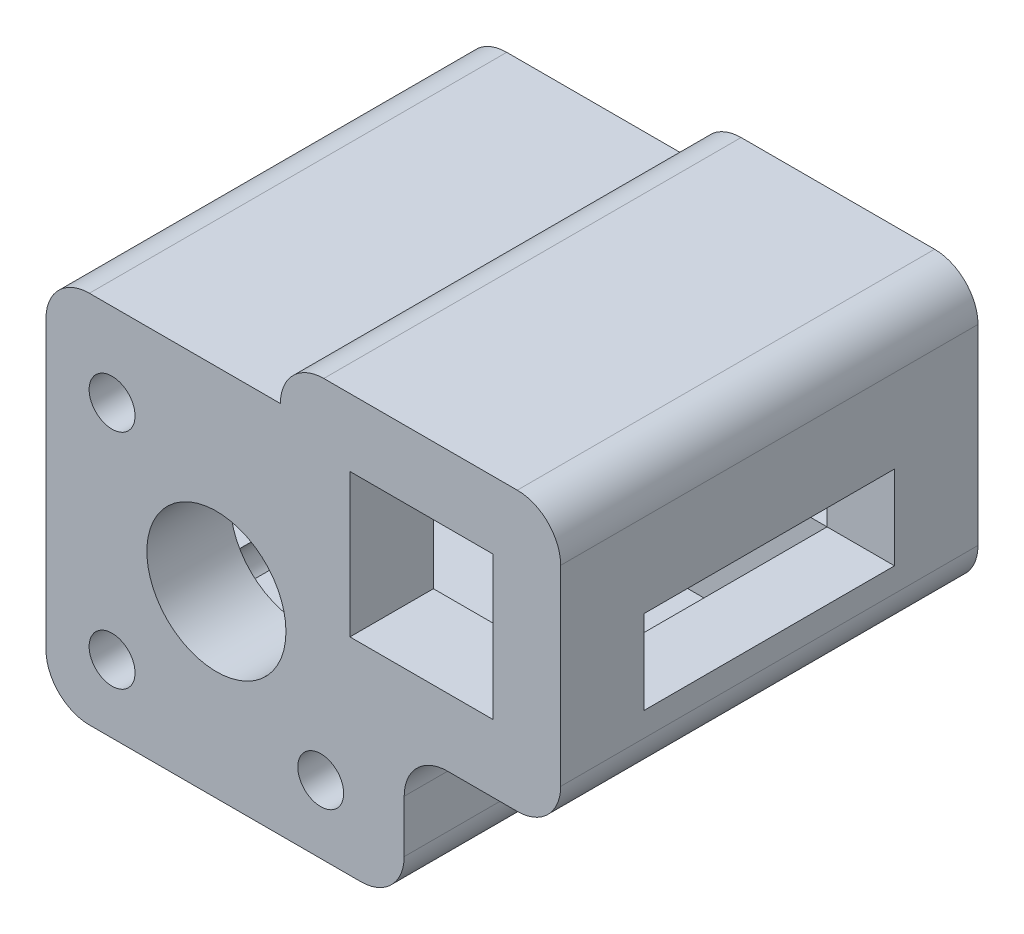
from build123d import *

# Parameters (mm, degrees)
SKETCH_1_W          = 37
SKETCH_1_H          = 30
SKETCH_1_W_2        = 10.3
SKETCH_1_H_2        = 10.3
EXTRUDE_1_DEPTH     = 30
SKETCH_2_R          = 1.65
SKETCH_2_W          = 11.25
SKETCH_2_H          = 10
CUT_EXTRUDE_1_DEPTH = 39.304699451
SKETCH_3_R          = 5
SKETCH_3_W          = 16.85
SKETCH_3_H          = 3.119518618
CUT_EXTRUDE_2_DEPTH = 39.304699451
SKETCH_4_W          = 18
SKETCH_4_H          = 14.880481382
CUT_EXTRUDE_3_DEPTH = 50.939963957
SKETCH_5_W          = 4.85
SKETCH_5_H          = 4.85
EXTRUDE_2_DEPTH     = 18
FILLET_2_R          = 3.12


with BuildPart() as part:
    # 草图1 → 凸台-拉伸1 (new body)
    with BuildSketch(Plane.XY):
        Rectangle(SKETCH_1_W, SKETCH_1_H)
        with Locations((8.5, 5)):
            Rectangle(SKETCH_1_W_2, SKETCH_1_H_2, mode=Mode.SUBTRACT)
    extrude(amount=EXTRUDE_1_DEPTH)

    # 草图2 → 切除-拉伸1 (cut, through all)
    with BuildSketch(Plane.XY.offset(30)):
        with Locations((-13.75, 5.880481382)):
            Circle(SKETCH_2_R)
        with Locations((-13.75, -10.119518618)):
            Circle(SKETCH_2_R)
        with Locations((1.25, -10.119518618)):
            Circle(SKETCH_2_R)
        with Locations((12.875, -10)):
            Rectangle(SKETCH_2_W, SKETCH_2_H)
    extrude(amount=-CUT_EXTRUDE_1_DEPTH, mode=Mode.SUBTRACT)

    # 草图3 → 切除-拉伸2 (cut, through all)
    with BuildSketch(Plane.XY.offset(30)):
        with Locations((-6.25, -2.119518618)):
            Circle(SKETCH_3_R)
        with Locations((-10.075, 13.440240691)):
            Rectangle(SKETCH_3_W, SKETCH_3_H)
    extrude(amount=-CUT_EXTRUDE_2_DEPTH, mode=Mode.SUBTRACT)

    # 草图4 → 切除-拉伸3 (cut, through all)
    with BuildSketch(Plane.ZY.offset(18.5)):
        with Locations((15, -1.559759309)):
            Rectangle(SKETCH_4_W, SKETCH_4_H)
    extrude(amount=-CUT_EXTRUDE_3_DEPTH, mode=Mode.SUBTRACT)

    # 草图5 → 凸台-拉伸2 (add)
    with BuildSketch(Plane.XY.offset(6)):
        with Locations((16.075, -2.575)):
            Rectangle(SKETCH_5_W, SKETCH_5_H)
    extrude(amount=EXTRUDE_2_DEPTH)

    # 圆角2
    # the kernel refuses this fillet: 3.12 mm, written as the material it adds along each edge
    with BuildSketch(Plane(origin=(7.25, -5, 6), x_dir=(0, -1, 0), z_dir=(0, 0, -1)), Plane(origin=(7.25, -5, 30), x_dir=(0, -1, 0), z_dir=(0, 0, -1))) as fillet_2_piece_1:
        with BuildLine():
            CenterArc((FILLET_2_R, -FILLET_2_R), FILLET_2_R, 90, 90)
            Line((0, -FILLET_2_R), (0, 0))
            Line((0, 0), (FILLET_2_R, 0))
        make_face()
    extrude(amount=6)
    # the kernel refuses this fillet: 3.12 mm, written as the material it takes off along each edge
    with BuildSketch(Plane(origin=(-1.65, 15, 37.8), x_dir=(1, 0, 0), z_dir=(0, 0, -1)), Plane(origin=(-18.5, 11.880481382, 37.8), x_dir=(1, 0, 0), z_dir=(0, 0, -1)), Plane(origin=(18.5, 15, -7.8), x_dir=(-1, 0, 0), z_dir=(0, 0, 1)), Plane(origin=(7.25, -15, 37.8), x_dir=(-1, 0, 0), z_dir=(0, 0, -1)), Plane(origin=(-18.5, -15, -7.8), x_dir=(1, 0, 0), z_dir=(0, 0, 1))) as fillet_2_2_piece_1:
        with BuildLine():
            CenterArc((FILLET_2_R, FILLET_2_R), FILLET_2_R, 180, 90)
            Line((0, FILLET_2_R), (0, 0))
            Line((0, 0), (FILLET_2_R, 0))
        make_face()
    extrude(amount=45.6, mode=Mode.SUBTRACT)
    with BuildSketch(Plane(origin=(18.5, -5, 37.8), x_dir=(0, 1, 0), z_dir=(0, 0, -1))) as fillet_2_2_piece_2:
        with BuildLine():
            CenterArc((FILLET_2_R, -FILLET_2_R), FILLET_2_R, 90, 90)
            Line((0, -FILLET_2_R), (0, 0))
            Line((0, 0), (FILLET_2_R, 0))
        make_face()
    extrude(amount=45.6, mode=Mode.SUBTRACT)


solid = part.part
